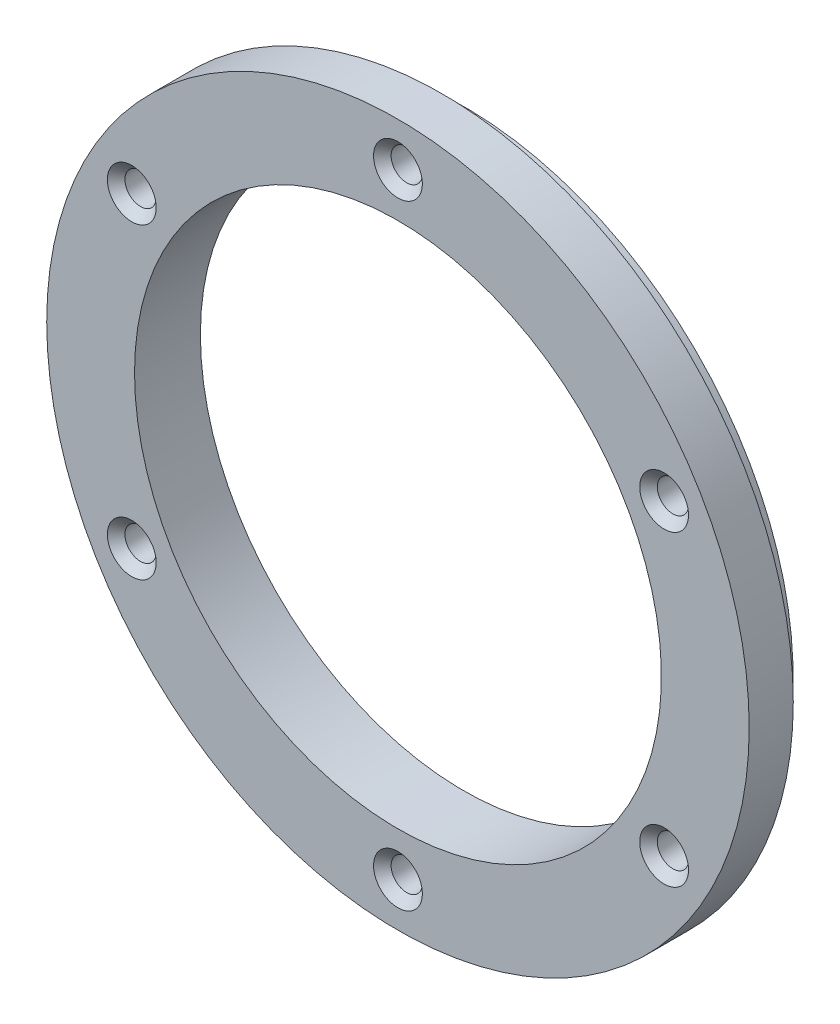
from build123d import *

# Parameters (mm, degrees)
SKETCH1_R                       = 25.4
SKETCH1_R_2                     = 19.05
BOSS_EXTRUDE1_DEPTH             = 4.7625
F_4_40_TAPPED_HOLE1_D           = 2.2606
F_4_40_TAPPED_HOLE1_DEPTH       = 7.62
F_4_40_TAPPED_HOLE1_CSINK_D     = 3.5306
F_4_40_TAPPED_HOLE1_CSINK_ANGLE = 90
F_4_40_TAPPED_HOLE1_TIP         = 0.679152758
SKETCH5_OUTSIDE_W               = 67.2
SKETCH5_OUTSIDE_H               = 67.2
SKETCH5_OUTSIDE_R               = 23.8125
CUT_EXTRUDE1_DEPTH              = 1.5748


with BuildPart() as part:
    # Sketch1 → Boss-Extrude1 (new body)
    with BuildSketch(Plane.XY):
        Circle(SKETCH1_R)
        Circle(SKETCH1_R_2, mode=Mode.SUBTRACT)
    extrude(amount=BOSS_EXTRUDE1_DEPTH)

    # #4-40 Tapped Hole1
    with Locations(Plane.XY.offset(4.7625)):
        with Locations((0, 22.225), (-19.247414599, 11.1125), (19.247414599, 11.1125), (19.247414599, -11.1125), (0, -22.225), (-19.247414599, -11.1125)):
            CounterSinkHole(F_4_40_TAPPED_HOLE1_D / 2, F_4_40_TAPPED_HOLE1_CSINK_D / 2, depth=F_4_40_TAPPED_HOLE1_DEPTH, counter_sink_angle=F_4_40_TAPPED_HOLE1_CSINK_ANGLE)
            with Locations((0, 0, -(F_4_40_TAPPED_HOLE1_DEPTH + F_4_40_TAPPED_HOLE1_TIP / 2))):  # 118° drill point
                Cone(0, F_4_40_TAPPED_HOLE1_D / 2, F_4_40_TAPPED_HOLE1_TIP, mode=Mode.SUBTRACT)

    # Sketch5 outside → Cut-Extrude1 (cut)
    with BuildSketch(Plane(origin=(0, 0, 0), x_dir=(-1, 0, 0), z_dir=(0, 0, -1))):
        Rectangle(SKETCH5_OUTSIDE_W, SKETCH5_OUTSIDE_H)
        Circle(SKETCH5_OUTSIDE_R, mode=Mode.SUBTRACT)
    extrude(amount=-CUT_EXTRUDE1_DEPTH, mode=Mode.SUBTRACT)


solid = part.part
